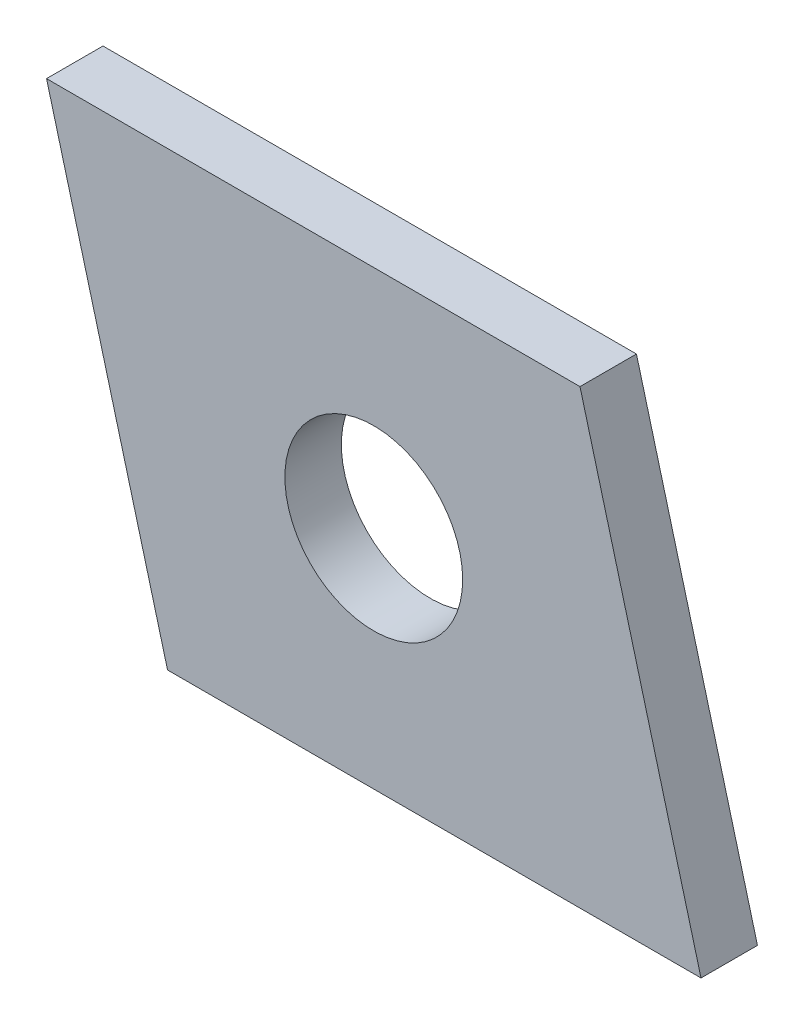
from build123d import *

# Parameters (mm, degrees)
SKETCH1_R           = 5
BOSS_EXTRUDE1_DEPTH = 3.175


with BuildPart() as part:
    # Sketch1 → Boss-Extrude1 (new body)
    with BuildSketch(Plane.XY):
        Polygon((-218.70690504, 117.173081746), (-211.900995552, 91.773081746), (-181.900995552, 91.773081746), (-188.70690504, 117.173081746), align=None)
        with Locations((-200.303950296, 104.473081746)):
            Circle(SKETCH1_R, mode=Mode.SUBTRACT)
    extrude(amount=-BOSS_EXTRUDE1_DEPTH)


solid = part.part
